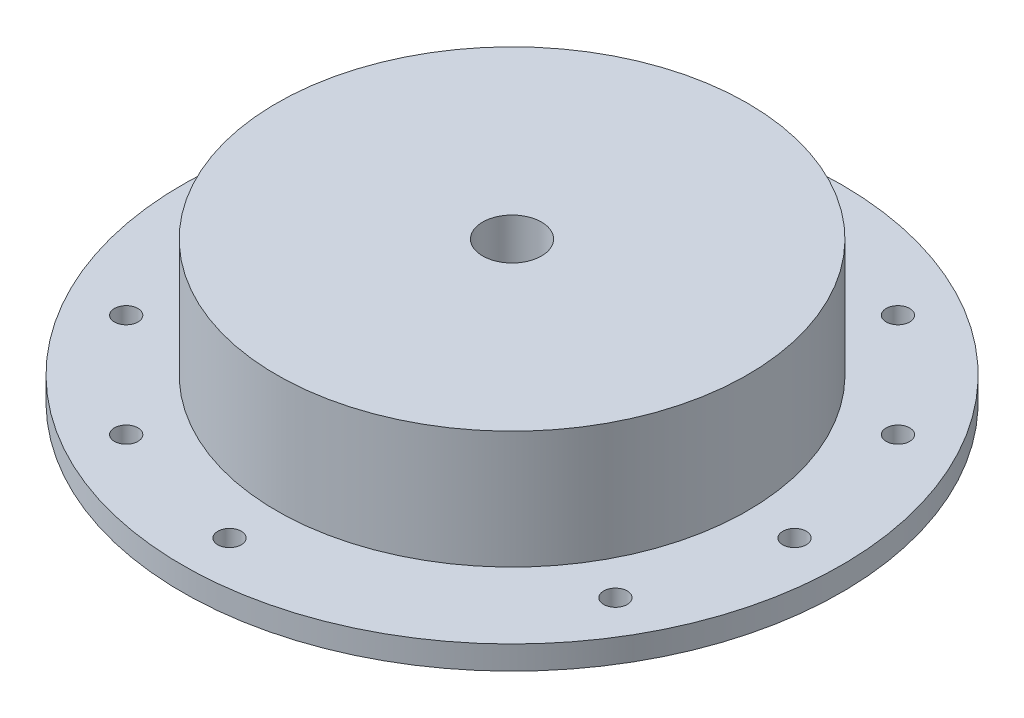
from build123d import *

# Parameters (mm, degrees)
F_1_4_0_25_DIAMETER_HOLE1_D = 6.35
CIRPATTERN2_COUNT           = 12


with BuildPart() as part:
    # Sketch1 → Revolve1 (revolve)
    with BuildSketch(Plane.XY):
        with BuildLine():
            Line((7.9375, 38.1), (7.9375, 11.1125))
            ThreePointArc((7.9375, 11.1125), (22.02778747, 2.86649456), (38.1, 0))
            Line((38.1, 0), (88.9, 0))
            Line((88.9, 0), (88.9, 6.35))
            Line((88.9, 6.35), (63.5, 6.35))
            Line((63.5, 6.35), (63.5, 38.1))
            Line((63.5, 38.1), (7.9375, 38.1))
        make_face()
    revolve(axis=Axis((0, 0, 0), (0, 1, 0)))

    # 1/4 (0.25) Diameter Hole1 (through all)
    with Locations(Plane(origin=(0, 6.35, 0), x_dir=(1, 0, 0), z_dir=(0, 1, 0))):
        with Locations((0, -76.2)):
            f_1_4_0_25_diameter_hole1 = Hole(F_1_4_0_25_DIAMETER_HOLE1_D / 2)

    # CirPattern2: 1/4 (0.25) Diameter Hole1 ×12 about axis, 1 skipped
    cirpattern2_axis = Axis((0, 0, 0), (0, 1, 0))
    add([f_1_4_0_25_diameter_hole1.rotate(cirpattern2_axis, i * 360 / CIRPATTERN2_COUNT) for i in range(1, CIRPATTERN2_COUNT) if i not in (1,)], mode=Mode.SUBTRACT)


solid = part.part
